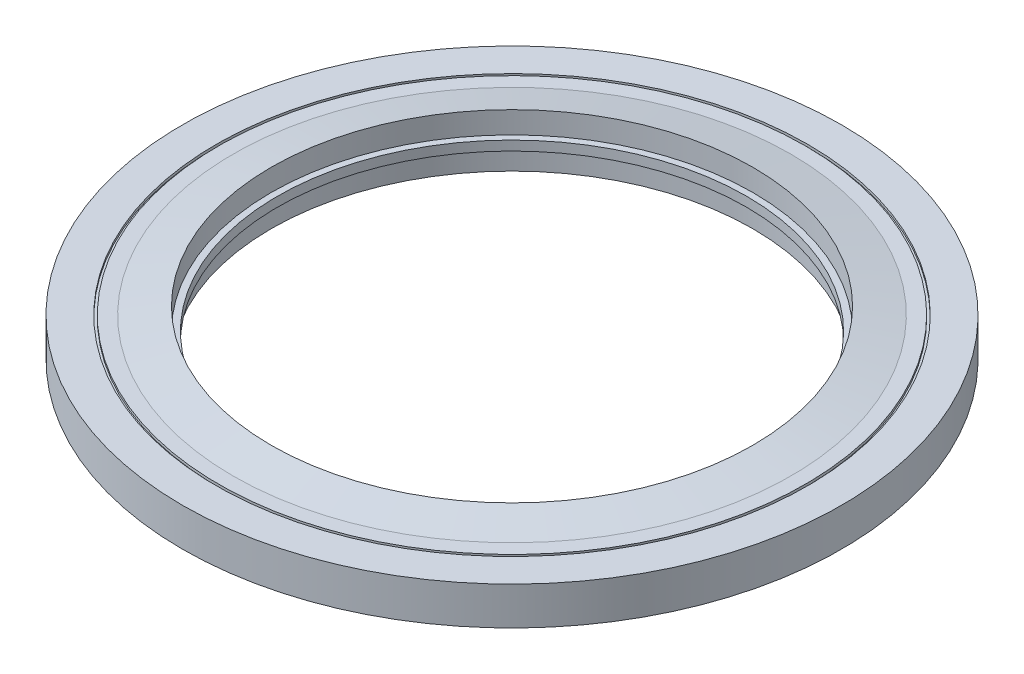
from build123d import *


with BuildPart() as part:
    # Sketch1 → Revolve1 (revolve)
    with BuildSketch(Plane.XY):
        Polygon((9.25, -0.1875), (9.25, 0.1875), (9.5, 0.1875), (9.5, 1.05), (11, 0.75), (11.566666667, 0.75), (11.566666667, 0.65), (11.666666667, 0.65), (11.666666667, 0.75), (13, 0.75), (13, -0.75), (11.666666667, -0.75), (11.666666667, -0.65), (11.566666667, -0.65), (11.566666667, -0.75), (11, -0.75), (9.5, -1.05), (9.5, -0.1875), align=None)
    revolve(axis=Axis((0, 0, 0), (0, 1, 0)))


solid = part.part
